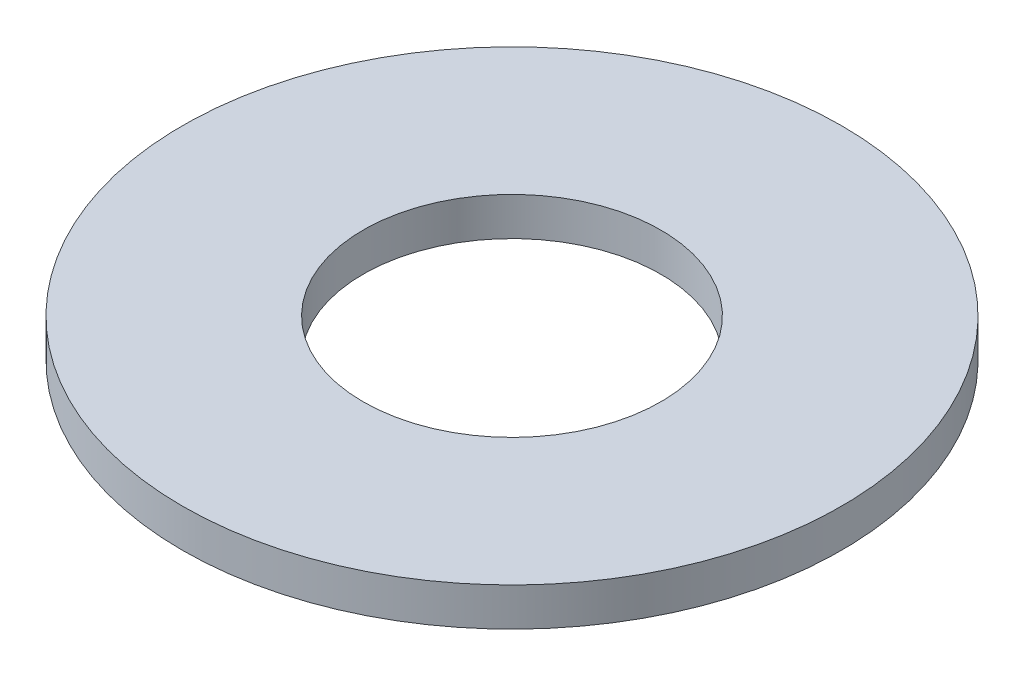
from build123d import *

# Parameters (mm, degrees)
SKETCH1_R           = 77.5
BOSS_EXTRUDE1_DEPTH = 9
SKETCH2_R           = 35
CUT_EXTRUDE1_DEPTH  = 110.970450577


with BuildPart() as part:
    # Sketch1 → Boss-Extrude1 (new body)
    with BuildSketch(Plane(origin=(0, 0, 0), x_dir=(1, 0, 0), z_dir=(0, 1, 0))):
        Circle(SKETCH1_R)
    extrude(amount=BOSS_EXTRUDE1_DEPTH)

    # Sketch2 → Cut-Extrude1 (cut, through all)
    with BuildSketch(Plane(origin=(0, 0, 0), x_dir=(1, 0, 0), z_dir=(0, 1, 0))):
        Circle(SKETCH2_R)
    extrude(amount=CUT_EXTRUDE1_DEPTH, mode=Mode.SUBTRACT)


solid = part.part
